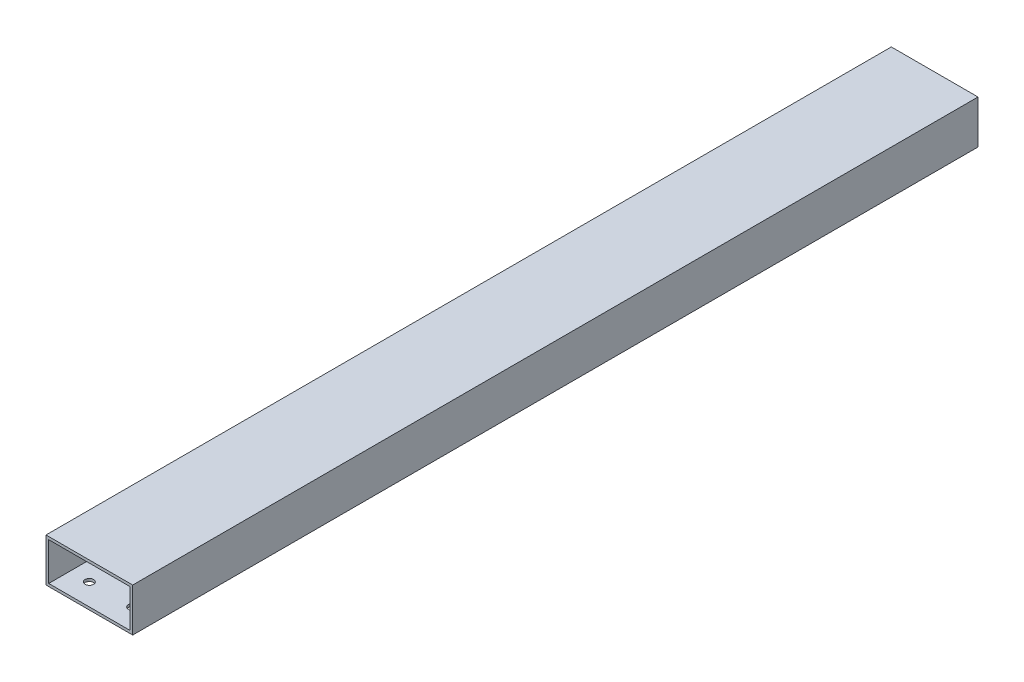
from build123d import *

# Parameters (mm, degrees)
SKETCH1_W           = 50.8
SKETCH1_H           = 25.4
BOSS_EXTRUDE1_DEPTH = 495.3
SHELL1_T            = -1.5875
CUT_EXTRUDE1_REACH  = 498.601
SKETCH2_R           = 2.4892
CUT_EXTRUDE2_REACH  = 498.601
SKETCH3_R           = 2.4892


with BuildPart() as part:
    # Sketch1 → Boss-Extrude1 (new body)
    with BuildSketch(Plane.XY):
        Rectangle(SKETCH1_W, SKETCH1_H)
    extrude(amount=BOSS_EXTRUDE1_DEPTH)

    # Shell1
    shell1_openings = [part.faces().sort_by_distance(p)[0] for p in [
        (0, 0, 0),
        (0, 0, 495.3),
    ]]
    offset(amount=SHELL1_T, openings=shell1_openings, kind=Kind.INTERSECTION)

    # Sketch2 → Cut-Extrude1 (cut, up to next)
    with BuildSketch(Plane(origin=(0, -12.7, 0), x_dir=(1, 0, 0), z_dir=(0, 1, 0)), mode=Mode.PRIVATE) as cut_extrude1_sk1:
        with Locations((-12.7, -25.4)):
            Circle(SKETCH2_R)
    cut_extrude1_tool1 = extrude(cut_extrude1_sk1.sketch, amount=CUT_EXTRUDE1_REACH, mode=Mode.PRIVATE) & part.part
    # Sketch2 → Cut-Extrude1 (cut, up to next)
    with BuildSketch(Plane(origin=(0, -12.7, 0), x_dir=(1, 0, 0), z_dir=(0, 1, 0)), mode=Mode.PRIVATE) as cut_extrude1_sk2:
        with Locations((12.7, -25.4)):
            Circle(SKETCH2_R)
    cut_extrude1_tool2 = extrude(cut_extrude1_sk2.sketch, amount=CUT_EXTRUDE1_REACH, mode=Mode.PRIVATE) & part.part
    # Sketch2 → Cut-Extrude1 (cut, up to next)
    with BuildSketch(Plane(origin=(0, -12.7, 0), x_dir=(1, 0, 0), z_dir=(0, 1, 0)), mode=Mode.PRIVATE) as cut_extrude1_sk3:
        with Locations((12.7, -50.8)):
            Circle(SKETCH2_R)
    cut_extrude1_tool3 = extrude(cut_extrude1_sk3.sketch, amount=CUT_EXTRUDE1_REACH, mode=Mode.PRIVATE) & part.part
    # Sketch2 → Cut-Extrude1 (cut, up to next)
    with BuildSketch(Plane(origin=(0, -12.7, 0), x_dir=(1, 0, 0), z_dir=(0, 1, 0)), mode=Mode.PRIVATE) as cut_extrude1_sk4:
        with Locations((12.7, -76.2)):
            Circle(SKETCH2_R)
    cut_extrude1_tool4 = extrude(cut_extrude1_sk4.sketch, amount=CUT_EXTRUDE1_REACH, mode=Mode.PRIVATE) & part.part
    # Sketch2 → Cut-Extrude1 (cut, up to next)
    with BuildSketch(Plane(origin=(0, -12.7, 0), x_dir=(1, 0, 0), z_dir=(0, 1, 0)), mode=Mode.PRIVATE) as cut_extrude1_sk5:
        with Locations((12.7, -101.6)):
            Circle(SKETCH2_R)
    cut_extrude1_tool5 = extrude(cut_extrude1_sk5.sketch, amount=CUT_EXTRUDE1_REACH, mode=Mode.PRIVATE) & part.part
    # Sketch2 → Cut-Extrude1 (cut, up to next)
    with BuildSketch(Plane(origin=(0, -12.7, 0), x_dir=(1, 0, 0), z_dir=(0, 1, 0)), mode=Mode.PRIVATE) as cut_extrude1_sk6:
        with Locations((12.7, -127)):
            Circle(SKETCH2_R)
    cut_extrude1_tool6 = extrude(cut_extrude1_sk6.sketch, amount=CUT_EXTRUDE1_REACH, mode=Mode.PRIVATE) & part.part
    # Sketch2 → Cut-Extrude1 (cut, up to next)
    with BuildSketch(Plane(origin=(0, -12.7, 0), x_dir=(1, 0, 0), z_dir=(0, 1, 0)), mode=Mode.PRIVATE) as cut_extrude1_sk7:
        with Locations((-12.7, -50.8)):
            Circle(SKETCH2_R)
    cut_extrude1_tool7 = extrude(cut_extrude1_sk7.sketch, amount=CUT_EXTRUDE1_REACH, mode=Mode.PRIVATE) & part.part
    # Sketch2 → Cut-Extrude1 (cut, up to next)
    with BuildSketch(Plane(origin=(0, -12.7, 0), x_dir=(1, 0, 0), z_dir=(0, 1, 0)), mode=Mode.PRIVATE) as cut_extrude1_sk8:
        with Locations((-12.7, -76.2)):
            Circle(SKETCH2_R)
    cut_extrude1_tool8 = extrude(cut_extrude1_sk8.sketch, amount=CUT_EXTRUDE1_REACH, mode=Mode.PRIVATE) & part.part
    # Sketch2 → Cut-Extrude1 (cut, up to next)
    with BuildSketch(Plane(origin=(0, -12.7, 0), x_dir=(1, 0, 0), z_dir=(0, 1, 0)), mode=Mode.PRIVATE) as cut_extrude1_sk9:
        with Locations((-12.7, -101.6)):
            Circle(SKETCH2_R)
    cut_extrude1_tool9 = extrude(cut_extrude1_sk9.sketch, amount=CUT_EXTRUDE1_REACH, mode=Mode.PRIVATE) & part.part
    # Sketch2 → Cut-Extrude1 (cut, up to next)
    with BuildSketch(Plane(origin=(0, -12.7, 0), x_dir=(1, 0, 0), z_dir=(0, 1, 0)), mode=Mode.PRIVATE) as cut_extrude1_sk10:
        with Locations((-12.7, -127)):
            Circle(SKETCH2_R)
    cut_extrude1_tool10 = extrude(cut_extrude1_sk10.sketch, amount=CUT_EXTRUDE1_REACH, mode=Mode.PRIVATE) & part.part
    add(cut_extrude1_tool1.solids().sort_by_distance((-12.7, -12.7, 25.4))[0], mode=Mode.SUBTRACT)
    add(cut_extrude1_tool2.solids().sort_by_distance((12.7, -12.7, 25.4))[0], mode=Mode.SUBTRACT)
    add(cut_extrude1_tool3.solids().sort_by_distance((12.7, -12.7, 50.8))[0], mode=Mode.SUBTRACT)
    add(cut_extrude1_tool4.solids().sort_by_distance((12.7, -12.7, 76.2))[0], mode=Mode.SUBTRACT)
    add(cut_extrude1_tool5.solids().sort_by_distance((12.7, -12.7, 101.6))[0], mode=Mode.SUBTRACT)
    add(cut_extrude1_tool6.solids().sort_by_distance((12.7, -12.7, 127))[0], mode=Mode.SUBTRACT)
    add(cut_extrude1_tool7.solids().sort_by_distance((-12.7, -12.7, 50.8))[0], mode=Mode.SUBTRACT)
    add(cut_extrude1_tool8.solids().sort_by_distance((-12.7, -12.7, 76.2))[0], mode=Mode.SUBTRACT)
    add(cut_extrude1_tool9.solids().sort_by_distance((-12.7, -12.7, 101.6))[0], mode=Mode.SUBTRACT)
    add(cut_extrude1_tool10.solids().sort_by_distance((-12.7, -12.7, 127))[0], mode=Mode.SUBTRACT)

    # Sketch3 → Cut-Extrude2 (cut, up to next)
    with BuildSketch(Plane.XZ.offset(12.7), mode=Mode.PRIVATE) as cut_extrude2_sk1:
        with Locations((-12.7, 457.2)):
            Circle(SKETCH3_R)
    cut_extrude2_tool1 = extrude(cut_extrude2_sk1.sketch, amount=-CUT_EXTRUDE2_REACH, mode=Mode.PRIVATE) & part.part
    # Sketch3 → Cut-Extrude2 (cut, up to next)
    with BuildSketch(Plane.XZ.offset(12.7), mode=Mode.PRIVATE) as cut_extrude2_sk2:
        with Locations((12.7, 457.2)):
            Circle(SKETCH3_R)
    cut_extrude2_tool2 = extrude(cut_extrude2_sk2.sketch, amount=-CUT_EXTRUDE2_REACH, mode=Mode.PRIVATE) & part.part
    # Sketch3 → Cut-Extrude2 (cut, up to next)
    with BuildSketch(Plane.XZ.offset(12.7), mode=Mode.PRIVATE) as cut_extrude2_sk3:
        with Locations((12.7, 469.9)):
            Circle(SKETCH3_R)
    cut_extrude2_tool3 = extrude(cut_extrude2_sk3.sketch, amount=-CUT_EXTRUDE2_REACH, mode=Mode.PRIVATE) & part.part
    # Sketch3 → Cut-Extrude2 (cut, up to next)
    with BuildSketch(Plane.XZ.offset(12.7), mode=Mode.PRIVATE) as cut_extrude2_sk4:
        with Locations((12.7, 482.6)):
            Circle(SKETCH3_R)
    cut_extrude2_tool4 = extrude(cut_extrude2_sk4.sketch, amount=-CUT_EXTRUDE2_REACH, mode=Mode.PRIVATE) & part.part
    # Sketch3 → Cut-Extrude2 (cut, up to next)
    with BuildSketch(Plane.XZ.offset(12.7), mode=Mode.PRIVATE) as cut_extrude2_sk5:
        with Locations((-12.7, 469.9)):
            Circle(SKETCH3_R)
    cut_extrude2_tool5 = extrude(cut_extrude2_sk5.sketch, amount=-CUT_EXTRUDE2_REACH, mode=Mode.PRIVATE) & part.part
    # Sketch3 → Cut-Extrude2 (cut, up to next)
    with BuildSketch(Plane.XZ.offset(12.7), mode=Mode.PRIVATE) as cut_extrude2_sk6:
        with Locations((-12.7, 482.6)):
            Circle(SKETCH3_R)
    cut_extrude2_tool6 = extrude(cut_extrude2_sk6.sketch, amount=-CUT_EXTRUDE2_REACH, mode=Mode.PRIVATE) & part.part
    add(cut_extrude2_tool1.solids().sort_by_distance((-12.7, -12.7, 457.2))[0], mode=Mode.SUBTRACT)
    add(cut_extrude2_tool2.solids().sort_by_distance((12.7, -12.7, 457.2))[0], mode=Mode.SUBTRACT)
    add(cut_extrude2_tool3.solids().sort_by_distance((12.7, -12.7, 469.9))[0], mode=Mode.SUBTRACT)
    add(cut_extrude2_tool4.solids().sort_by_distance((12.7, -12.7, 482.6))[0], mode=Mode.SUBTRACT)
    add(cut_extrude2_tool5.solids().sort_by_distance((-12.7, -12.7, 469.9))[0], mode=Mode.SUBTRACT)
    add(cut_extrude2_tool6.solids().sort_by_distance((-12.7, -12.7, 482.6))[0], mode=Mode.SUBTRACT)


solid = part.part
